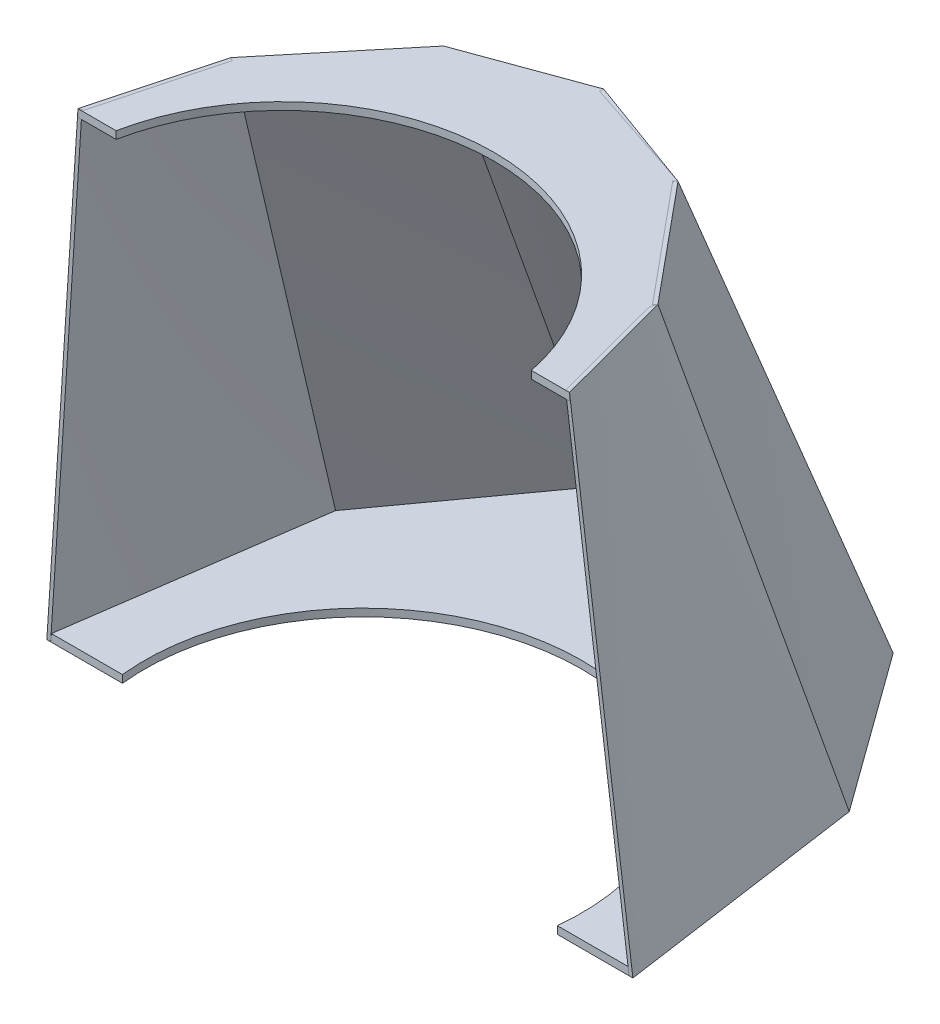
from build123d import *

# Parameters (mm, degrees)
BOSS_EXTRUDE1_DEPTH = 10
BOSS_EXTRUDE2_DEPTH = 10


with BuildPart() as part:
    # Loft2: read off the stored shape, not the designer's step
    # Loft2: loft between two sections, ruled curve by curve
    loft2_from = [
        Edge.make_bspline([(-335.224381982, 0, 135.502179225), (-310.047520364, 0, 100.736721017), (-284.870658745, 0, 65.97126281), (-234.516935508, 0, -3.559653606), (-209.34007389, 0, -38.325111813), (-184.163212271, 0, -73.090570021)], [0, 0, 0, 0, 0.5, 0.5, 1, 1, 1, 1], 3),
        Edge.make_bspline([(-184.163212271, 0, -73.090570021), (-153.469343559, 0, -88.571968338), (-122.775474847, 0, -104.053366656), (-61.387737424, 0, -135.01616329), (-30.693868712, 0, -150.497561608), (0, 0, -165.978959925)], [0, 0, 0, 0, 0.5, 0.5, 1, 1, 1, 1], 3),
        Edge.make_bspline([(-382.449580547, 0, 467.207653654), (-374.57871412, 0, 411.923407915), (-366.707847692, 0, 356.639162177), (-350.966114837, 0, 246.070670701), (-343.09524841, 0, 190.786424963), (-335.224381982, 0, 135.502179225)], [0, 0, 0, 0, 0.5, 0.5, 1, 1, 1, 1], 3),
        Edge.make_bspline([(0, 0, -165.978959925), (30.693868712, 0, -150.497561608), (61.387737424, 0, -135.01616329), (122.775474847, 0, -104.053366656), (153.469343559, 0, -88.571968338), (184.163212271, 0, -73.090570021)], [0, 0, 0, 0, 0.5, 0.5, 1, 1, 1, 1], 3),
        Edge.make_bspline([(184.163212271, 0, -73.090570021), (209.34007389, 0, -38.325111813), (234.516935508, 0, -3.559653606), (284.870658745, 0, 65.97126281), (310.047520364, 0, 100.736721017), (335.224381982, 0, 135.502179225)], [0, 0, 0, 0, 0.5, 0.5, 1, 1, 1, 1], 3),
        Edge.make_bspline([(335.224381982, 0, 135.502179225), (343.09524841, 0, 190.786424963), (350.966114837, 0, 246.070670701), (366.707847692, 0, 356.639162177), (374.57871412, 0, 411.923407915), (382.449580547, 0, 467.207653654)], [0, 0, 0, 0, 0.5, 0.5, 1, 1, 1, 1], 3),
        Edge.make_bspline([(387.5, 0, 467.207653654), (379.583333333, 0, 411.601711225), (371.666666667, 0, 355.995768797), (355.833333333, 0, 244.783883941), (347.916666667, 0, 189.177941512), (340, 0, 133.571999084)], [0, 0, 0, 0, 0.5, 0.5, 1, 1, 1, 1], 3),
        Edge.make_bspline([(340, 0, 133.571999084), (314.583333333, 0, 98.475406182), (289.166666667, 0, 63.37881328), (238.333333333, 0, -6.814372524), (212.916666667, 0, -41.910965426), (187.5, 0, -77.007558328)], [0, 0, 0, 0, 0.5, 0.5, 1, 1, 1, 1], 3),
        Edge.make_bspline([(187.5, 0, -77.007558328), (156.25, 0, -92.769458594), (125, 0, -108.531358861), (62.5, 0, -140.055159393), (31.25, 0, -155.817059659), (0, 0, -171.578959925)], [0, 0, 0, 0, 0.5, 0.5, 1, 1, 1, 1], 3),
        Edge.make_bspline([(0, 0, -171.578959925), (-31.25, 0, -155.817059659), (-62.5, 0, -140.055159393), (-125, 0, -108.531358861), (-156.25, 0, -92.769458594), (-187.5, 0, -77.007558328)], [0, 0, 0, 0, 0.5, 0.5, 1, 1, 1, 1], 3),
        Edge.make_bspline([(-187.5, 0, -77.007558328), (-212.916666667, 0, -41.910965426), (-238.333333333, 0, -6.814372524), (-289.166666667, 0, 63.37881328), (-314.583333333, 0, 98.475406182), (-340, 0, 133.571999084)], [0, 0, 0, 0, 0.5, 0.5, 1, 1, 1, 1], 3),
        Edge.make_bspline([(-340, 0, 133.571999084), (-347.916666667, 0, 189.177941512), (-355.833333333, 0, 244.783883941), (-371.666666667, 0, 355.995768797), (-379.583333333, 0, 411.601711225), (-387.5, 0, 467.207653654)], [0, 0, 0, 0, 0.5, 0.5, 1, 1, 1, 1], 3),
        Edge.make_line((387.5, 0, 467.207653654), (382.449580547, 0, 467.207653654)),
        Edge.make_line((-382.449580547, 0, 467.207653654), (-387.5, 0, 467.207653654)),
    ]
    loft2_to = [
        Edge.make_bspline([(-277.950447238, 650, 331.424430821), (-256.960724605, 650, 306.057310412), (-235.971001972, 650, 280.690190004), (-193.991556706, 650, 229.955949187), (-173.001834073, 650, 204.588828778), (-152.012111441, 650, 179.22170837)], [0, 0, 0, 0, 0.5, 0.5, 1, 1, 1, 1], 3),
        Edge.make_bspline([(-152.012111441, 650, 179.22170837), (-126.676759534, 650, 169.975360428), (-101.341407627, 650, 160.729012487), (-50.670703814, 650, 142.236316603), (-25.335351907, 650, 132.989968662), (0, 650, 123.74362072)], [0, 0, 0, 0, 0.5, 0.5, 1, 1, 1, 1], 3),
        Edge.make_bspline([(-319.825399172, 650, 488.512241267), (-312.846240516, 650, 462.330939526), (-305.86708186, 650, 436.149637785), (-291.908764549, 650, 383.787034303), (-284.929605893, 650, 357.605732562), (-277.950447238, 650, 331.424430821)], [0, 0, 0, 0, 0.5, 0.5, 1, 1, 1, 1], 3),
        Edge.make_bspline([(0, 650, 123.74362072), (25.335351907, 650, 132.989968662), (50.670703814, 650, 142.236316603), (101.341407627, 650, 160.729012487), (126.676759534, 650, 169.975360428), (152.012111441, 650, 179.22170837)], [0, 0, 0, 0, 0.5, 0.5, 1, 1, 1, 1], 3),
        Edge.make_bspline([(152.012111441, 650, 179.22170837), (173.001834073, 650, 204.588828778), (193.991556706, 650, 229.955949187), (235.971001972, 650, 280.690190004), (256.960724605, 650, 306.057310412), (277.950447238, 650, 331.424430821)], [0, 0, 0, 0, 0.5, 0.5, 1, 1, 1, 1], 3),
        Edge.make_bspline([(277.950447238, 650, 331.424430821), (284.929605893, 650, 357.605732562), (291.908764549, 650, 383.787034303), (305.86708186, 650, 436.149637785), (312.846240516, 650, 462.330939526), (319.825399172, 650, 488.512241267)], [0, 0, 0, 0, 0.5, 0.5, 1, 1, 1, 1], 3),
        Edge.make_bspline([(325, 650, 488.512241267), (317.916666667, 650, 461.940143328), (310.833333333, 650, 435.368045389), (296.666666667, 650, 382.22384951), (289.583333333, 650, 355.651751571), (282.5, 650, 329.079653632)], [0, 0, 0, 0, 0.5, 0.5, 1, 1, 1, 1], 3),
        Edge.make_bspline([(282.5, 650, 329.079653632), (261.25, 650, 303.397975122), (240, 650, 277.716296611), (197.5, 650, 226.35293959), (176.25, 650, 200.67126108), (155, 650, 174.98958257)], [0, 0, 0, 0, 0.5, 0.5, 1, 1, 1, 1], 3),
        Edge.make_bspline([(155, 650, 174.98958257), (129.166666667, 650, 165.561492154), (103.333333333, 650, 156.133401738), (51.666666667, 650, 137.277220906), (25.833333333, 650, 127.849130491), (0, 650, 118.421040075)], [0, 0, 0, 0, 0.5, 0.5, 1, 1, 1, 1], 3),
        Edge.make_bspline([(0, 650, 118.421040075), (-25.833333333, 650, 127.849130491), (-51.666666667, 650, 137.277220906), (-103.333333333, 650, 156.133401738), (-129.166666667, 650, 165.561492154), (-155, 650, 174.98958257)], [0, 0, 0, 0, 0.5, 0.5, 1, 1, 1, 1], 3),
        Edge.make_bspline([(-155, 650, 174.98958257), (-176.25, 650, 200.67126108), (-197.5, 650, 226.35293959), (-240, 650, 277.716296611), (-261.25, 650, 303.397975122), (-282.5, 650, 329.079653632)], [0, 0, 0, 0, 0.5, 0.5, 1, 1, 1, 1], 3),
        Edge.make_bspline([(-282.5, 650, 329.079653632), (-289.583333333, 650, 355.651751571), (-296.666666667, 650, 382.22384951), (-310.833333333, 650, 435.368045389), (-317.916666667, 650, 461.940143328), (-325, 650, 488.512241267)], [0, 0, 0, 0, 0.5, 0.5, 1, 1, 1, 1], 3),
        Edge.make_line((325, 650, 488.512241267), (319.825399172, 650, 488.512241267)),
        Edge.make_line((-319.825399172, 650, 488.512241267), (-325, 650, 488.512241267)),
    ]
    loft2 = Solid(Shell([*[Face.make_surface_from_curves(loft2_from[k], loft2_to[k]) for k in range(14)], Face(Wire(loft2_from)), Face(Wire(loft2_to))]))
    add(loft2)

    # Sketch1<271> → Boss-Extrude1 (add)
    with BuildSketch(Plane(origin=(0, 0, 0), x_dir=(1, 0, 0), z_dir=(0, 1, 0))):
        with BuildLine():
            Line((-381.737726173, -462.207653654), (-382.449580547, -467.207653654))
            Line((-382.449580547, -467.207653654), (-287.5, -467.207653654))
            ThreePointArc((-287.5, -467.207653654), (0, -147.214818982), (287.5, -467.207653654))
            Line((287.5, -467.207653654), (382.449580547, -467.207653654))
            Line((382.449580547, -467.207653654), (381.737726173, -462.207653654))
            Line((381.737726173, -462.207653654), (335.224381982, -135.502179225))
            Line((335.224381982, -135.502179225), (184.163212271, 73.090570021))
            Line((184.163212271, 73.090570021), (0, 165.978959925))
            Line((0, 165.978959925), (-184.163212271, 73.090570021))
            Line((-184.163212271, 73.090570021), (-335.224381982, -135.502179225))
            Line((-335.224381982, -135.502179225), (-381.737726173, -462.207653654))
        make_face()
    extrude(amount=BOSS_EXTRUDE1_DEPTH)


with BuildPart() as body_2:
    # Sketch2<164> → Boss-Extrude2 (new body)
    with BuildSketch(Plane(origin=(0, 650, 0), x_dir=(1, 0, 0), z_dir=(0, 1, 0))):
        with BuildLine():
            Line((0, -118.421040075), (-155, -174.98958257))
            Line((-155, -174.98958257), (-282.5, -329.079653632))
            Line((-282.5, -329.079653632), (-325, -488.512241267))
            Line((-325, -488.512241267), (-274.563332973, -488.512241267))
            ThreePointArc((-274.563332973, -488.512241267), (0, -263.421040075), (274.563332973, -488.512241267))
            Line((274.563332973, -488.512241267), (325, -488.512241267))
            Line((325, -488.512241267), (282.5, -329.079653632))
            Line((282.5, -329.079653632), (155, -174.98958257))
            Line((155, -174.98958257), (0, -118.421040075))
        make_face()
    extrude(amount=-BOSS_EXTRUDE2_DEPTH)


solid = Compound([part.part, body_2.part])
